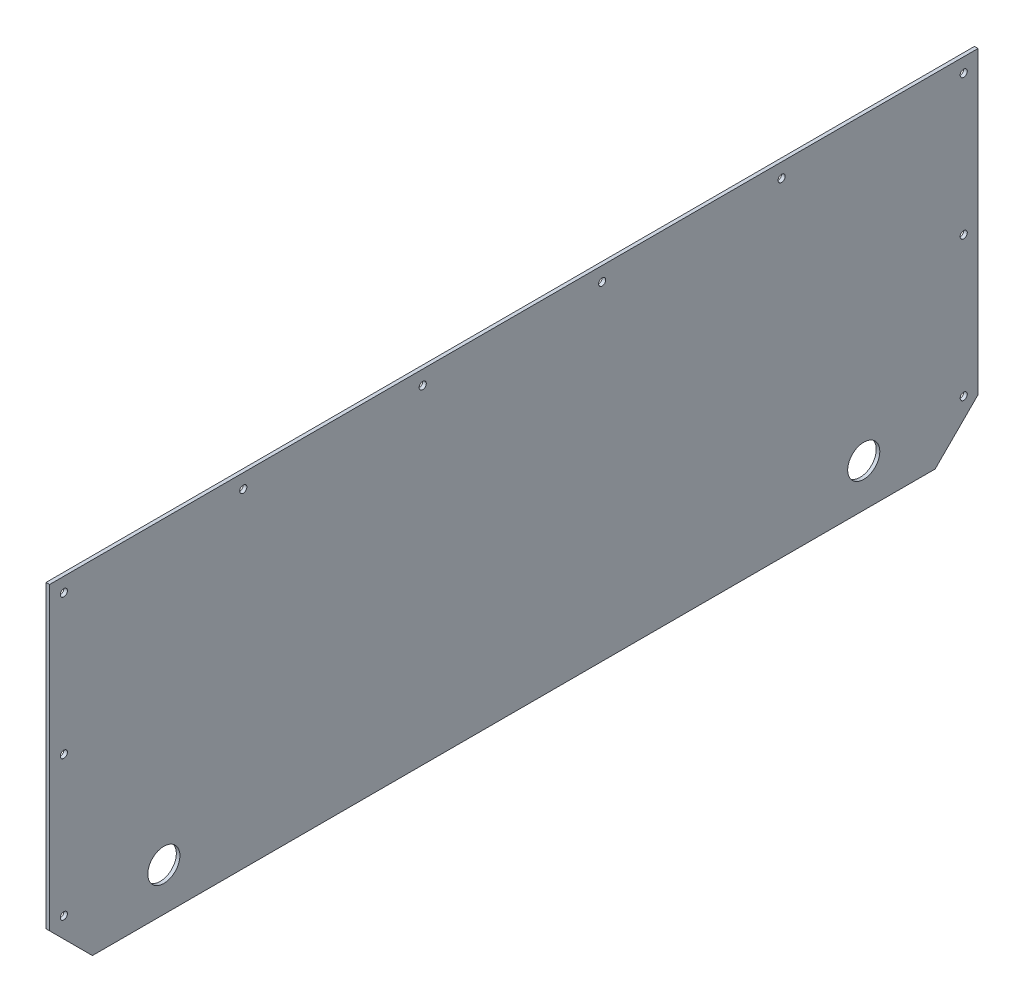
from build123d import *

# Parameters (mm, degrees)
SKETCH1_W          = 3.175
SKETCH1_H          = 304.8
BASE_FLANGE1_DEPTH = 412.75
SKETCH6_R          = 14.2875
SKETCH6_R_2        = 3.175
CUT_EXTRUDE1_DEPTH = 514.103969118


# Sheet-metal steps are written as plain solids
with BuildPart() as part:
    # Sketch1 → Base-Flange1 (new, symmetric)
    with BuildSketch(Plane.XY):
        with Locations((1.5875, 152.4)):
            Rectangle(SKETCH1_W, SKETCH1_H)
    extrude(amount=BASE_FLANGE1_DEPTH, both=True)

    # Sketch6 → Cut-Extrude1 (cut, through all)
    with BuildSketch(Plane(origin=(3.175, 0, 0), x_dir=(0, 0, -1), z_dir=(1, 0, 0))):
        with Locations((-311.15, 38.1)):
            Circle(SKETCH6_R)
        with Locations((311.15, 38.1)):
            Circle(SKETCH6_R)
        with Locations((-400.05, 292.1)):
            Circle(SKETCH6_R_2)
        with Locations((-400.05, 167.730256121)):
            Circle(SKETCH6_R_2)
        with Locations((-400.05, 43.360512242)):
            Circle(SKETCH6_R_2)
        with Locations(Location((400.05, 43.360512242, 0), (0, 0, 180))):
            Circle(SKETCH6_R_2)
        with Locations(Location((400.05, 292.1, 0), (0, 0, 180))):
            Circle(SKETCH6_R_2)
        with Locations(Location((400.05, 167.730256121, 0), (0, 0, 180))):
            Circle(SKETCH6_R_2)
        with Locations((-240.50625, 292.1)):
            Circle(SKETCH6_R_2)
        with Locations((-80.9625, 292.1)):
            Circle(SKETCH6_R_2)
        with Locations((78.58125, 292.1)):
            Circle(SKETCH6_R_2)
        with Locations((238.125, 292.1)):
            Circle(SKETCH6_R_2)
        Polygon((-412.75, 38.1), (-374.65, 0), (-412.75, 0), align=None)
        Polygon((412.75, 0), (412.75, 38.1), (374.65, 0), align=None)
    extrude(amount=-CUT_EXTRUDE1_DEPTH, mode=Mode.SUBTRACT)


solid = part.part
